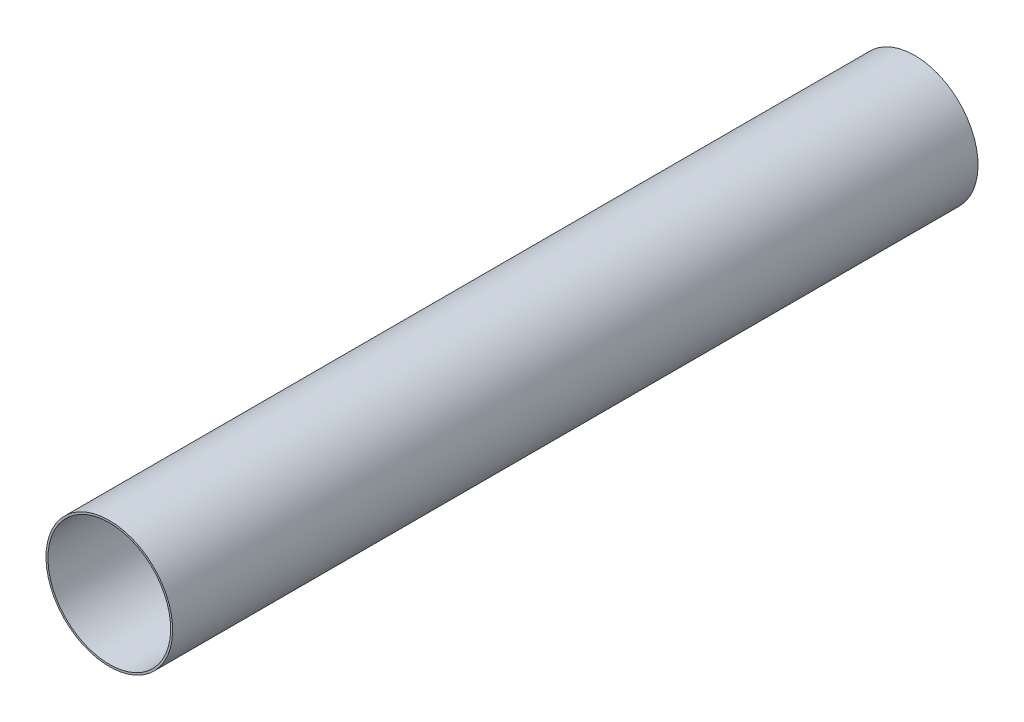
from build123d import *

# Parameters (mm, degrees)
ESQUISSE2_W = 650
ESQUISSE2_H = 1.58


with BuildPart() as part:
    # Esquisse2 → Révolution1 (revolve)
    with BuildSketch(Plane(origin=(0, 0, 0), x_dir=(0, 0, -1), z_dir=(1, 0, 0))):
        with Locations((-335, 50.32)):
            Rectangle(ESQUISSE2_W, ESQUISSE2_H)
    revolve(axis=Axis((0, 0, 0), (0, 0, 1)))


solid = part.part
